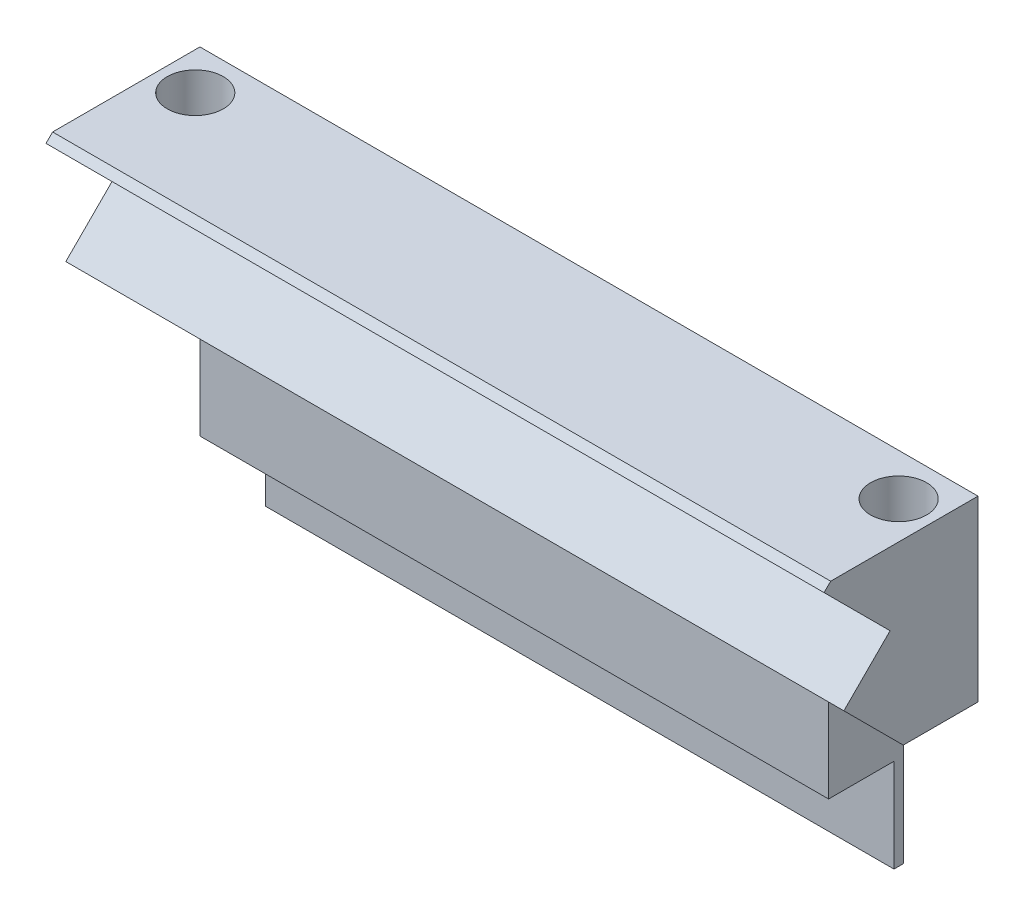
from build123d import *

# Parameters (mm, degrees)
STOCK_GOUX_START         = 56.852102372
STOCK_GOUX_LIKED_1_DEPTH = 33.663747278
BOSS_EXTRUDE1_DEPTH      = 33.663747
BOSS_EXTRUDE2_DEPTH      = 4
BOSS_EXTRUDE3_DEPTH      = 4
SKETCH4_R                = 0.64999997
CUT_EXTRUDE1_DEPTH       = 152.446320344
CUT_EXTRUDE2_DEPTH       = 0.4
SKETCH6_R                = 1.5
CUT_EXTRUDE3_DEPTH       = 5.08


# Read off the part's stored shape, not the designer's step: Stock-Goux Liked-1
with BuildPart() as part:
    # Stock-Goux Liked-1 outline → Stock-Goux Liked-1 (new body)
    with BuildSketch(Plane.YZ.offset(STOCK_GOUX_START)):
        Polygon((-51.598102466, 113.704878), (-51.598102466, 110.204877888), (-56.598102372, 110.204877888), (-56.598102372, 109.704877872), (-45.441248273, 109.704877872), (-37.552161083, 117.593965062), (-37.905714485, 117.947518464), (-41.441248325, 114.411984624), (-43.916122138, 116.886858438), (-47.098102576, 113.704878), align=None)
    extrude(amount=STOCK_GOUX_LIKED_1_DEPTH)

    # Sketch1 → Boss-Extrude1 (add)
    with BuildSketch(Plane(origin=(90.51584965, 0, 0), x_dir=(0, 0, -1), z_dir=(1, 0, 0))):
        Polygon((-109.704877872, -45.441248273), (-109.704877872, -37.552161083), (-117.593965062, -37.552161083), align=None)
    extrude(amount=-BOSS_EXTRUDE1_DEPTH)

    # Sketch2 → Boss-Extrude2 (add)
    with BuildSketch(Plane.ZY.offset(-56.852102372)):
        Polygon((113.704878, -47.098102576), (109.704877872, -47.098102576), (109.704877872, -37.552161083), (117.593965062, -37.552161083), (117.947518464, -37.905714485), (114.411984624, -41.441248325), (116.886858438, -43.916122138), align=None)
    extrude(amount=BOSS_EXTRUDE2_DEPTH)

    # Sketch3 → Boss-Extrude3 (add)
    with BuildSketch(Plane(origin=(90.51584965, 0, 0), x_dir=(0, 0, -1), z_dir=(1, 0, 0))):
        Polygon((-113.704878, -47.098102576), (-109.704877872, -47.098102576), (-109.704877872, -37.552161083), (-117.593965062, -37.552161083), (-117.947518464, -37.905714485), (-114.411984624, -41.441248325), (-116.886858438, -43.916122138), align=None)
    extrude(amount=BOSS_EXTRUDE3_DEPTH)

    # Sketch4 → Cut-Extrude1 (cut, through all)
    with BuildSketch(Plane.XZ.offset(47.098102576)):
        with Locations(Location((92.51584965, 111.954877944, 0), (0, 0, 270))):
            Circle(SKETCH4_R)
    cut_extrude1 = extrude(amount=-CUT_EXTRUDE1_DEPTH, mode=Mode.SUBTRACT)

    # Mirror2: Cut-Extrude1 across plane
    add(cut_extrude1.mirror(Plane(origin=(73.683976011, 0, 0), x_dir=(0, 0, 1), z_dir=(1, 0, 0))), mode=Mode.SUBTRACT)

    # Sketch5 → Cut-Extrude2 (cut)
    with BuildSketch(Plane(origin=(0, 0, 109.704877872), x_dir=(-1, 0, 0), z_dir=(0, 0, -1))):
        with BuildLine():
            Line((-76.075617186, -43.318922194), (-76.075617186, -43.888793989))
            add(Edge.make_bspline(
                [(-76.075617186, -43.888793989), (-76.139538978, -43.873355233), (-76.264500854, -43.843173727), (-76.443039741, -43.780222416), (-76.611992416, -43.711643767), (-76.768195292, -43.629294963), (-76.914787587, -43.539471937), (-77.048444427, -43.436560714), (-77.172565093, -43.325309217), (-77.282716253, -43.202255381), (-77.382461562, -43.073207666), (-77.467506308, -42.936347713), (-77.540665843, -42.794429035), (-77.600936835, -42.646468351), (-77.646340285, -42.492025153), (-77.679281918, -42.332495694), (-77.700674368, -42.167461915), (-77.702762181, -42.055434144), (-77.703822314, -41.998549598)],
                knots=[0, 0, 0, 0, 1.162005537, 2.271625781, 3.343758855, 4.383309926, 5.390229558, 6.379919256, 7.361854164, 8.333198761, 9.295911338, 10.242430842, 11.177959212, 12.116337295, 13.062827104, 14.020064771, 14.994644689, 16, 16, 16, 16], degree=3))
            add(Edge.make_bspline(
                [(-77.703822314, -41.998549598), (-77.701319996, -41.915668052), (-77.696369943, -41.751712846), (-77.651168037, -41.510842747), (-77.579639583, -41.278565518), (-77.480808678, -41.057423597), (-77.358911695, -40.852013012), (-77.213832816, -40.669248788), (-77.048371226, -40.511608204), (-76.865613573, -40.379356976), (-76.670295721, -40.27580662), (-76.469272578, -40.199449914), (-76.263021002, -40.152964864), (-76.123761367, -40.146940425), (-76.053992586, -40.143922194)],
                knots=[0, 0, 0, 0, 1.083050992, 2.142477498, 3.193116406, 4.255571735, 5.30263384, 6.308962982, 7.297363603, 8.282367274, 9.249857812, 10.179914175, 11.08814088, 12, 12, 12, 12], degree=3))
            add(Edge.make_bspline(
                [(-76.053992586, -40.143922194), (-75.986851687, -40.146033281), (-75.855467367, -40.15016435), (-75.663658365, -40.185241216), (-75.482880033, -40.244271293), (-75.312371353, -40.326040719), (-75.15321343, -40.43188896), (-75.00504817, -40.560109425), (-74.867218412, -40.711607111), (-74.788261654, -40.826413184), (-74.747612378, -40.885518749)],
                knots=[0, 0, 0, 0, 1.024540389, 2.004866551, 2.965041327, 3.920577974, 4.882998113, 5.874504559, 6.905732034, 8, 8, 8, 8], degree=3))
            add(Edge.make_bspline(
                [(-74.747612378, -40.885518749), (-74.715113083, -40.817883608), (-74.650618225, -40.683661659), (-74.522124234, -40.502557078), (-74.377408106, -40.335645539), (-74.263212693, -40.243656204), (-74.205725359, -40.197347675)],
                knots=[0, 0, 0, 0, 1.015663554, 2.015584519, 3.001021554, 4, 4, 4, 4], degree=3))
            add(Edge.make_bspline(
                [(-74.205725359, -40.197347675), (-74.163892009, -40.166792668), (-74.080910361, -40.106183014), (-73.947494274, -40.031369974), (-73.812599429, -39.963499153), (-73.672610221, -39.910612326), (-73.529149182, -39.869656882), (-73.381969977, -39.840381509), (-73.230952422, -39.822194854), (-73.128785494, -39.819590352), (-73.077430086, -39.818281169)],
                knots=[0, 0, 0, 0, 1.025084078, 2.033381695, 3.024893161, 4.013698104, 4.991890475, 5.976764909, 6.982997093, 8, 8, 8, 8], degree=3))
            add(Edge.make_bspline(
                [(-73.077430086, -39.818281169), (-72.988512904, -39.821537398), (-72.811096985, -39.828034533), (-72.548971743, -39.88609203), (-72.292774916, -39.976132066), (-72.04760793, -40.103855132), (-71.81844159, -40.260217785), (-71.611884948, -40.444185319), (-71.437120387, -40.658387778), (-71.289330919, -40.895062092), (-71.172293376, -41.152579903), (-71.08793697, -41.426890731), (-71.037340068, -41.716407105), (-71.031268974, -41.914392881), (-71.028181288, -42.015086057)],
                knots=[0, 0, 0, 0, 0.955697303, 1.906897079, 2.875188111, 3.870982192, 4.871999088, 5.854111427, 6.836107184, 7.836239895, 8.848948182, 9.870701427, 10.917064451, 12, 12, 12, 12], degree=3))
            add(Edge.make_bspline(
                [(-71.028181288, -42.015086057), (-71.029770214, -42.082971085), (-71.03289669, -42.216546184), (-71.053889344, -42.412991677), (-71.093273096, -42.600110727), (-71.142803615, -42.779720334), (-71.211285106, -42.949109752), (-71.292927731, -43.110715491), (-71.389825107, -43.263829176), (-71.502140187, -43.407541515), (-71.627860123, -43.541698969), (-71.769073476, -43.662883652), (-71.923144715, -43.772436343), (-72.091459735, -43.869660957), (-72.273547112, -43.954966676), (-72.4701365, -44.026517714), (-72.679703854, -44.088990608), (-72.825706955, -44.118093073), (-72.900617186, -44.133024759)],
                knots=[0, 0, 0, 0, 1.048603596, 2.063302207, 3.045874044, 3.999447474, 4.937100059, 5.862643889, 6.7929026, 7.7308982, 8.676022965, 9.627908155, 10.600123445, 11.591992905, 12.626222643, 13.701663232, 14.820785756, 16, 16, 16, 16], degree=3))
            Line((-72.900617186, -44.133024759), (-72.900617186, -43.563152964))
            add(Edge.make_bspline(
                [(-72.900617186, -43.563152964), (-72.851723976, -43.548306135), (-72.756622436, -43.519427763), (-72.619752167, -43.470270966), (-72.494279699, -43.414267101), (-72.379284606, -43.35418783), (-72.27363439, -43.291089792), (-72.180122714, -43.220486999), (-72.094642275, -43.147608693), (-72.046482765, -43.092673295), (-72.022912859, -43.065787178)],
                knots=[0, 0, 0, 0, 1.198163088, 2.33053128, 3.407730985, 4.417276592, 5.372219308, 6.28897303, 7.162600585, 8, 8, 8, 8], degree=3))
            add(Edge.make_bspline(
                [(-72.022912859, -43.065787178), (-71.995513327, -43.030229419), (-71.94079884, -42.959223657), (-71.870776253, -42.843589465), (-71.810838593, -42.721552229), (-71.762118751, -42.592094244), (-71.72554788, -42.455198144), (-71.699225888, -42.311419238), (-71.681849284, -42.16052162), (-71.680270254, -42.057536944), (-71.679463339, -42.004909775)],
                knots=[0, 0, 0, 0, 0.946083416, 1.889246487, 2.84504177, 3.809995578, 4.801312957, 5.829064617, 6.89060985, 8, 8, 8, 8], degree=3))
            add(Edge.make_bspline(
                [(-71.679463339, -42.004909775), (-71.680580768, -41.945485563), (-71.682765802, -41.829286646), (-71.702860298, -41.65973283), (-71.732125477, -41.498429318), (-71.777324746, -41.34716701), (-71.833170005, -41.203964518), (-71.903289255, -41.070829239), (-71.985557536, -40.946013447), (-72.079064295, -40.831115811), (-72.181429007, -40.72780039), (-72.288495579, -40.636832988), (-72.399812584, -40.559499673), (-72.515996032, -40.497118038), (-72.636564804, -40.447859183), (-72.761857252, -40.414325376), (-72.890848006, -40.391009056), (-72.978530564, -40.389110202), (-73.02273257, -40.388152964)],
                knots=[0, 0, 0, 0, 1.217147791, 2.380027433, 3.494444702, 4.572153297, 5.609568379, 6.639424714, 7.649109417, 8.668170816, 9.669597737, 10.625200337, 11.543417969, 12.441394052, 13.322311151, 14.205496177, 15.095365482, 16, 16, 16, 16], degree=3))
            add(Edge.make_bspline(
                [(-73.02273257, -40.388152964), (-73.081895072, -40.39093521), (-73.199925692, -40.396485859), (-73.3736414, -40.438686775), (-73.541075629, -40.508726152), (-73.700059811, -40.604856525), (-73.845611274, -40.724738389), (-73.976406445, -40.862703865), (-74.084229706, -41.022506322), (-74.158794458, -41.169475897), (-74.209659091, -41.299681811), (-74.243541433, -41.411106059), (-74.272231733, -41.535850429), (-74.298924055, -41.672405015), (-74.321641341, -41.821799159), (-74.340585783, -41.98387009), (-74.355744213, -42.158650688), (-74.362513486, -42.279647517), (-74.366001801, -42.341999118)],
                knots=[0, 0, 0, 0, 1.070505987, 2.135685285, 3.216438728, 4.346150463, 5.486482244, 6.621737109, 7.7759408, 8.963942283, 9.59839197, 10.305095457, 11.070459627, 11.915156775, 12.823989992, 13.805807174, 14.869297358, 16, 16, 16, 16], degree=3))
            Line((-74.366001801, -42.341999118), (-75.017283852, -42.341999118))
            add(Edge.make_bspline(
                [(-75.017283852, -42.341999118), (-75.018809153, -42.263466821), (-75.021795797, -42.109695136), (-75.050669999, -41.884479267), (-75.097024447, -41.670033169), (-75.16325695, -41.469439558), (-75.24127084, -41.286958717), (-75.331413736, -41.128005999), (-75.433440936, -40.996765899), (-75.545399019, -40.891867311), (-75.664822791, -40.812137014), (-75.790055878, -40.75479729), (-75.921594744, -40.720622764), (-76.011397636, -40.716078263), (-76.056536657, -40.713793989)],
                knots=[0, 0, 0, 0, 1.322091412, 2.58874672, 3.817242262, 5.011895168, 6.140903042, 7.155122731, 8.080855046, 8.929742606, 9.727943956, 10.488587771, 11.240295418, 12, 12, 12, 12], degree=3))
            add(Edge.make_bspline(
                [(-76.056536657, -40.713793989), (-76.089703227, -40.714529395), (-76.155686544, -40.715992449), (-76.252389139, -40.735176783), (-76.346131292, -40.762679558), (-76.435844182, -40.802610281), (-76.521711422, -40.85434671), (-76.604674968, -40.916751009), (-76.683662816, -40.991601722), (-76.75908247, -41.075435333), (-76.827693483, -41.168266491), (-76.887739473, -41.267929765), (-76.938677009, -41.37402103), (-76.980820221, -41.485860698), (-77.012486847, -41.603969954), (-77.03523311, -41.727750359), (-77.049452113, -41.857450016), (-77.051499485, -41.945935793), (-77.052540263, -41.990917387)],
                knots=[0, 0, 0, 0, 0.884325644, 1.759323928, 2.622595547, 3.489424008, 4.37295195, 5.294616785, 6.255907374, 7.274251867, 8.302369084, 9.333474657, 10.37669385, 11.44084034, 12.520297356, 13.637342342, 14.798947025, 16, 16, 16, 16], degree=3))
            add(Edge.make_bspline(
                [(-77.052540263, -41.990917387), (-77.050015934, -42.063219699), (-77.045085334, -42.20444293), (-77.001899867, -42.408032851), (-76.932996773, -42.597297928), (-76.850749723, -42.741966652), (-76.76955965, -42.848796465), (-76.698653035, -42.925136053), (-76.619853483, -43.000103265), (-76.528307574, -43.068766136), (-76.430214969, -43.138206065), (-76.320589147, -43.201424055), (-76.202289746, -43.262855211), (-76.118659094, -43.299871265), (-76.075617186, -43.318922194)],
                knots=[0, 0, 0, 0, 1.472543308, 2.876219568, 4.221790263, 5.565193594, 6.249813518, 6.953379497, 7.687249741, 8.463570142, 9.283606569, 10.136032583, 11.040678096, 12, 12, 12, 12], degree=3))
        make_face()
    extrude(amount=-CUT_EXTRUDE2_DEPTH, mode=Mode.SUBTRACT)

    # Sketch6 → Cut-Extrude3 (cut)
    with BuildSketch(Plane(origin=(0, -37.552161083, 0), x_dir=(1, 0, 0), z_dir=(0, 1, 0))):
        with Locations(Location((54.852102372, -111.954877944, 0), (0, 0, 270))):
            Circle(SKETCH6_R)
        with Locations(Location((92.51584965, -111.954877944, 0), (0, 0, 270))):
            Circle(SKETCH6_R)
    extrude(amount=-CUT_EXTRUDE3_DEPTH, mode=Mode.SUBTRACT)


solid = part.part
